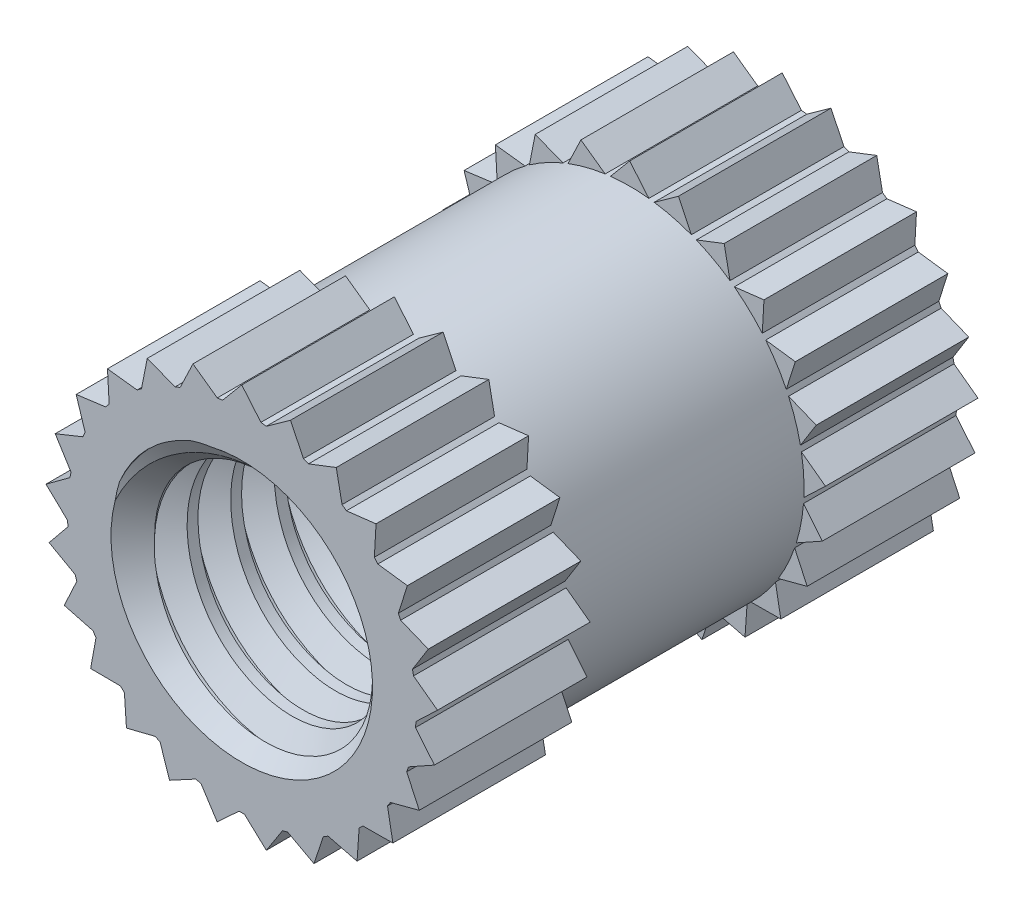
from build123d import *

# Parameters (mm, degrees)
SKETCH1_R             = 2
BOSS_EXTRUDE1_DEPTH   = 3.1
THREAD1_PITCH         = 0.5
BOSS_EXTRUDE2_DEPTH   = 1.75
CIRPATTERN1_COUNT     = 25
MIRROR1_COPY_1_DEPTH  = 1.75
MIRROR1_COPY_2_DEPTH  = 1.75
MIRROR1_COPY_3_DEPTH  = 1.75
MIRROR1_COPY_4_DEPTH  = 1.75
MIRROR1_COPY_5_DEPTH  = 1.75
MIRROR1_COPY_6_DEPTH  = 1.75
MIRROR1_COPY_7_DEPTH  = 1.75
MIRROR1_COPY_8_DEPTH  = 1.75
MIRROR1_COPY_9_DEPTH  = 1.75
MIRROR1_COPY_10_DEPTH = 1.75
MIRROR1_COPY_11_DEPTH = 1.75
MIRROR1_COPY_12_DEPTH = 1.75
MIRROR1_COPY_13_DEPTH = 1.75
MIRROR1_COPY_14_DEPTH = 1.75
MIRROR1_COPY_15_DEPTH = 1.75
MIRROR1_COPY_16_DEPTH = 1.75
MIRROR1_COPY_17_DEPTH = 1.75
MIRROR1_COPY_18_DEPTH = 1.75
MIRROR1_COPY_19_DEPTH = 1.75
MIRROR1_COPY_20_DEPTH = 1.75
MIRROR1_COPY_21_DEPTH = 1.75
MIRROR1_COPY_22_DEPTH = 1.75
MIRROR1_COPY_23_DEPTH = 1.75
MIRROR1_COPY_24_DEPTH = 1.75


with BuildPart() as part:
    # Sketch1 → Boss-Extrude1 (new, symmetric)
    with BuildSketch(Plane.XY):
        with Locations(Location((0, 0, 0), (0, 0, 180))):
            Circle(SKETCH1_R)
    extrude(amount=BOSS_EXTRUDE1_DEPTH, both=True)

    # Sketch3 → Tap Drill for M3x0.5 Tap1 (revolve, cut)
    with BuildSketch(Plane(origin=(0, 0, 3.1), x_dir=(0, -1, 0), z_dir=(1, 0, 0))):
        Polygon((0, 0), (0, 6.2), (1.5, 6.2), (1.25, 5.95), (1.25, 0.25), (1.5, 0), align=None)
    revolve(axis=Axis((0, 0, 9.45), (0, 0, -1)), mode=Mode.SUBTRACT)

    # Thread1: the profile of Thread Profile1 profile screwed along a right-hand helix of 16 turns, 6 arcs to a turn; built about Z, then put on its axis
    thread1_z = Axis((0, 0, 0), (0, 0, 1))
    thread1_corners = [(1.2497, 0, -0.000173205), (1.520632937, 0, 0.156249999), (1.520632937, 0, 0.218749999), (1.2497, 0, 0.375173204)]
    with BuildLine(mode=Mode.PRIVATE) as thread1_profile:
        Line(thread1_corners[0], thread1_corners[1])
        Line(thread1_corners[1], thread1_corners[2])
        Line(thread1_corners[2], thread1_corners[3])
        Line(thread1_corners[3], thread1_corners[0])
    thread1_cap = Face(thread1_profile.wire())
    thread1_turn_angles = [0, 30, 60, 90, 120, 150, 180, 210, 240, 270, 300, 330, 360]
    thread1_turn_weights = [1, 0.8660254037844387, 1, 0.8660254037844387, 1, 0.8660254037844387, 1, 0.8660254037844387, 1, 0.8660254037844387, 1, 0.8660254037844387, 1]
    thread1_turn_rails = [Edge.make_bspline([Vector(p[0], p[1], 0).rotate(thread1_z, thread1_turn_angles[k]) / thread1_turn_weights[k] + Vector(0, 0, p[2] + THREAD1_PITCH * thread1_turn_angles[k] / 360) for k in range(13)], [0, 0, 0, 1, 1, 2, 2, 3, 3, 4, 4, 5, 5, 6, 6, 6], 2, thread1_turn_weights) for p in thread1_corners]
    thread1_turn_sides = [Face.make_surface_from_curves(thread1_turn_rails[p[0]], thread1_turn_rails[p[1]]) for p in [(0, 1), (1, 2), (2, 3), (3, 0)]]
    thread1 = Plane(origin=(0, 0, 3.85), x_dir=(-1, 0, 0), z_dir=(0, 0, -1)) * Solid(Shell([*[p.moved(Location((0, 0, THREAD1_PITCH * i))) for i in range(16) for p in thread1_turn_sides], thread1_cap, thread1_cap.rotate(thread1_z, 5760).moved(Location((0, 0, THREAD1_PITCH * 5760 / 360)))]))
    add(thread1, mode=Mode.SUBTRACT)

    # Sketch6 → Boss-Extrude2 (add)
    with BuildSketch(Plane.XY.offset(3.1)):
        with BuildLine():
            Line((0, 2.25), (-0.219954708, 1.987868186))
            ThreePointArc((-0.219954708, 1.987868186), (0, 2), (0.219954708, 1.987868186))
            Line((0.219954708, 1.987868186), (0, 2.25))
        make_face()
    boss_extrude2 = extrude(amount=-BOSS_EXTRUDE2_DEPTH)

    # CirPattern1: Boss-Extrude2 ×25 about axis
    cirpattern1_axis = Axis((0, 0, 0), (0, 0, 1))
    for i in range(1, CIRPATTERN1_COUNT):
        add(boss_extrude2.rotate(cirpattern1_axis, i * 360 / CIRPATTERN1_COUNT))

    # Mirror1: Boss-Extrude2 across plane
    add(boss_extrude2.mirror(Plane.XY))

    # Mirror1 copy 1 sketch → Mirror1 copy 1 (add)
    with BuildSketch(Plane(origin=(0, 0, -3.1), x_dir=(0.9685831611286311, 0.2486898871648548, 0), z_dir=(0, 0, -1))):
        with BuildLine():
            Line((0, -2.25), (-0.219954708, -1.987868186))
            ThreePointArc((-0.219954708, -1.987868186), (0, -2), (0.219954708, -1.987868186))
            Line((0.219954708, -1.987868186), (0, -2.25))
        make_face()
    extrude(amount=-MIRROR1_COPY_1_DEPTH)

    # Mirror1 copy 2 sketch → Mirror1 copy 2 (add)
    with BuildSketch(Plane(origin=(0, 0, -3.1), x_dir=(0.8763066800438636, 0.4817536741017153, 0), z_dir=(0, 0, -1))):
        with BuildLine():
            Line((0, -2.25), (-0.219954708, -1.987868186))
            ThreePointArc((-0.219954708, -1.987868186), (0, -2), (0.219954708, -1.987868186))
            Line((0.219954708, -1.987868186), (0, -2.25))
        make_face()
    extrude(amount=-MIRROR1_COPY_2_DEPTH)

    # Mirror1 copy 3 sketch → Mirror1 copy 3 (add)
    with BuildSketch(Plane(origin=(0, 0, -3.1), x_dir=(0.7289686274214116, 0.6845471059286887, 0), z_dir=(0, 0, -1))):
        with BuildLine():
            Line((0, -2.25), (-0.219954708, -1.987868186))
            ThreePointArc((-0.219954708, -1.987868186), (0, -2), (0.219954708, -1.987868186))
            Line((0.219954708, -1.987868186), (0, -2.25))
        make_face()
    extrude(amount=-MIRROR1_COPY_3_DEPTH)

    # Mirror1 copy 4 sketch → Mirror1 copy 4 (add)
    with BuildSketch(Plane(origin=(0, 0, -3.1), x_dir=(0.5358267949789965, 0.8443279255020151, 0), z_dir=(0, 0, -1))):
        with BuildLine():
            Line((0, -2.25), (-0.219954708, -1.987868186))
            ThreePointArc((-0.219954708, -1.987868186), (0, -2), (0.219954708, -1.987868186))
            Line((0.219954708, -1.987868186), (0, -2.25))
        make_face()
    extrude(amount=-MIRROR1_COPY_4_DEPTH)

    # Mirror1 copy 5 sketch → Mirror1 copy 5 (add)
    with BuildSketch(Plane(origin=(0, 0, -3.1), x_dir=(0.30901699437494745, 0.9510565162951535, 0), z_dir=(0, 0, -1))):
        with BuildLine():
            Line((0, -2.25), (-0.219954708, -1.987868186))
            ThreePointArc((-0.219954708, -1.987868186), (0, -2), (0.219954708, -1.987868186))
            Line((0.219954708, -1.987868186), (0, -2.25))
        make_face()
    extrude(amount=-MIRROR1_COPY_5_DEPTH)

    # Mirror1 copy 6 sketch → Mirror1 copy 6 (add)
    with BuildSketch(Plane(origin=(0, 0, -3.1), x_dir=(0.0627905195293133, 0.9980267284282716, 0), z_dir=(0, 0, -1))):
        with BuildLine():
            Line((0, -2.25), (-0.219954708, -1.987868186))
            ThreePointArc((-0.219954708, -1.987868186), (0, -2), (0.219954708, -1.987868186))
            Line((0.219954708, -1.987868186), (0, -2.25))
        make_face()
    extrude(amount=-MIRROR1_COPY_6_DEPTH)

    # Mirror1 copy 7 sketch → Mirror1 copy 7 (add)
    with BuildSketch(Plane(origin=(0, 0, -3.1), x_dir=(-0.1873813145857246, 0.9822872507286887, 0), z_dir=(0, 0, -1))):
        with BuildLine():
            Line((0, -2.25), (-0.219954708, -1.987868186))
            ThreePointArc((-0.219954708, -1.987868186), (0, -2), (0.219954708, -1.987868186))
            Line((0.219954708, -1.987868186), (0, -2.25))
        make_face()
    extrude(amount=-MIRROR1_COPY_7_DEPTH)

    # Mirror1 copy 8 sketch → Mirror1 copy 8 (add)
    with BuildSketch(Plane(origin=(0, 0, -3.1), x_dir=(-0.4257792915650727, 0.9048270524660195, 0), z_dir=(0, 0, -1))):
        with BuildLine():
            Line((0, -2.25), (-0.219954708, -1.987868186))
            ThreePointArc((-0.219954708, -1.987868186), (0, -2), (0.219954708, -1.987868186))
            Line((0.219954708, -1.987868186), (0, -2.25))
        make_face()
    extrude(amount=-MIRROR1_COPY_8_DEPTH)

    # Mirror1 copy 9 sketch → Mirror1 copy 9 (add)
    with BuildSketch(Plane(origin=(0, 0, -3.1), x_dir=(-0.6374239897486897, 0.7705132427757893, 0), z_dir=(0, 0, -1))):
        with BuildLine():
            Line((0, -2.25), (-0.219954708, -1.987868186))
            ThreePointArc((-0.219954708, -1.987868186), (0, -2), (0.219954708, -1.987868186))
            Line((0.219954708, -1.987868186), (0, -2.25))
        make_face()
    extrude(amount=-MIRROR1_COPY_9_DEPTH)

    # Mirror1 copy 10 sketch → Mirror1 copy 10 (add)
    with BuildSketch(Plane(origin=(0, 0, -3.1), x_dir=(-0.8090169943749473, 0.5877852522924732, 0), z_dir=(0, 0, -1))):
        with BuildLine():
            Line((0, -2.25), (-0.219954708, -1.987868186))
            ThreePointArc((-0.219954708, -1.987868186), (0, -2), (0.219954708, -1.987868186))
            Line((0.219954708, -1.987868186), (0, -2.25))
        make_face()
    extrude(amount=-MIRROR1_COPY_10_DEPTH)

    # Mirror1 copy 11 sketch → Mirror1 copy 11 (add)
    with BuildSketch(Plane(origin=(0, 0, -3.1), x_dir=(-0.9297764858882515, 0.36812455268467775, 0), z_dir=(0, 0, -1))):
        with BuildLine():
            Line((0, -2.25), (-0.219954708, -1.987868186))
            ThreePointArc((-0.219954708, -1.987868186), (0, -2), (0.219954708, -1.987868186))
            Line((0.219954708, -1.987868186), (0, -2.25))
        make_face()
    extrude(amount=-MIRROR1_COPY_11_DEPTH)

    # Mirror1 copy 12 sketch → Mirror1 copy 12 (add)
    with BuildSketch(Plane(origin=(0, 0, -3.1), x_dir=(-0.9921147013144779, 0.1253332335643041, 0), z_dir=(0, 0, -1))):
        with BuildLine():
            Line((0, -2.25), (-0.219954708, -1.987868186))
            ThreePointArc((-0.219954708, -1.987868186), (0, -2), (0.219954708, -1.987868186))
            Line((0.219954708, -1.987868186), (0, -2.25))
        make_face()
    extrude(amount=-MIRROR1_COPY_12_DEPTH)

    # Mirror1 copy 13 sketch → Mirror1 copy 13 (add)
    with BuildSketch(Plane(origin=(0, 0, -3.1), x_dir=(-0.9921147013144779, -0.12533323356430429, 0), z_dir=(0, 0, -1))):
        with BuildLine():
            Line((0, -2.25), (-0.219954708, -1.987868186))
            ThreePointArc((-0.219954708, -1.987868186), (0, -2), (0.219954708, -1.987868186))
            Line((0.219954708, -1.987868186), (0, -2.25))
        make_face()
    extrude(amount=-MIRROR1_COPY_13_DEPTH)

    # Mirror1 copy 14 sketch → Mirror1 copy 14 (add)
    with BuildSketch(Plane(origin=(0, 0, -3.1), x_dir=(-0.9297764858882515, -0.3681245526846779, 0), z_dir=(0, 0, -1))):
        with BuildLine():
            Line((0, -2.25), (-0.219954708, -1.987868186))
            ThreePointArc((-0.219954708, -1.987868186), (0, -2), (0.219954708, -1.987868186))
            Line((0.219954708, -1.987868186), (0, -2.25))
        make_face()
    extrude(amount=-MIRROR1_COPY_14_DEPTH)

    # Mirror1 copy 15 sketch → Mirror1 copy 15 (add)
    with BuildSketch(Plane(origin=(0, 0, -3.1), x_dir=(-0.8090169943749476, -0.587785252292473, 0), z_dir=(0, 0, -1))):
        with BuildLine():
            Line((0, -2.25), (-0.219954708, -1.987868186))
            ThreePointArc((-0.219954708, -1.987868186), (0, -2), (0.219954708, -1.987868186))
            Line((0.219954708, -1.987868186), (0, -2.25))
        make_face()
    extrude(amount=-MIRROR1_COPY_15_DEPTH)

    # Mirror1 copy 16 sketch → Mirror1 copy 16 (add)
    with BuildSketch(Plane(origin=(0, 0, -3.1), x_dir=(-0.6374239897486895, -0.7705132427757894, 0), z_dir=(0, 0, -1))):
        with BuildLine():
            Line((0, -2.25), (-0.219954708, -1.987868186))
            ThreePointArc((-0.219954708, -1.987868186), (0, -2), (0.219954708, -1.987868186))
            Line((0.219954708, -1.987868186), (0, -2.25))
        make_face()
    extrude(amount=-MIRROR1_COPY_16_DEPTH)

    # Mirror1 copy 17 sketch → Mirror1 copy 17 (add)
    with BuildSketch(Plane(origin=(0, 0, -3.1), x_dir=(-0.42577929156507216, -0.9048270524660198, 0), z_dir=(0, 0, -1))):
        with BuildLine():
            Line((0, -2.25), (-0.219954708, -1.987868186))
            ThreePointArc((-0.219954708, -1.987868186), (0, -2), (0.219954708, -1.987868186))
            Line((0.219954708, -1.987868186), (0, -2.25))
        make_face()
    extrude(amount=-MIRROR1_COPY_17_DEPTH)

    # Mirror1 copy 18 sketch → Mirror1 copy 18 (add)
    with BuildSketch(Plane(origin=(0, 0, -3.1), x_dir=(-0.18738131458572463, -0.9822872507286887, 0), z_dir=(0, 0, -1))):
        with BuildLine():
            Line((0, -2.25), (-0.219954708, -1.987868186))
            ThreePointArc((-0.219954708, -1.987868186), (0, -2), (0.219954708, -1.987868186))
            Line((0.219954708, -1.987868186), (0, -2.25))
        make_face()
    extrude(amount=-MIRROR1_COPY_18_DEPTH)

    # Mirror1 copy 19 sketch → Mirror1 copy 19 (add)
    with BuildSketch(Plane(origin=(0, 0, -3.1), x_dir=(0.06279051952931372, -0.9980267284282716, 0), z_dir=(0, 0, -1))):
        with BuildLine():
            Line((0, -2.25), (-0.219954708, -1.987868186))
            ThreePointArc((-0.219954708, -1.987868186), (0, -2), (0.219954708, -1.987868186))
            Line((0.219954708, -1.987868186), (0, -2.25))
        make_face()
    extrude(amount=-MIRROR1_COPY_19_DEPTH)

    # Mirror1 copy 20 sketch → Mirror1 copy 20 (add)
    with BuildSketch(Plane(origin=(0, 0, -3.1), x_dir=(0.30901699437494723, -0.9510565162951536, 0), z_dir=(0, 0, -1))):
        with BuildLine():
            Line((0, -2.25), (-0.219954708, -1.987868186))
            ThreePointArc((-0.219954708, -1.987868186), (0, -2), (0.219954708, -1.987868186))
            Line((0.219954708, -1.987868186), (0, -2.25))
        make_face()
    extrude(amount=-MIRROR1_COPY_20_DEPTH)

    # Mirror1 copy 21 sketch → Mirror1 copy 21 (add)
    with BuildSketch(Plane(origin=(0, 0, -3.1), x_dir=(0.5358267949789968, -0.844327925502015, 0), z_dir=(0, 0, -1))):
        with BuildLine():
            Line((0, -2.25), (-0.219954708, -1.987868186))
            ThreePointArc((-0.219954708, -1.987868186), (0, -2), (0.219954708, -1.987868186))
            Line((0.219954708, -1.987868186), (0, -2.25))
        make_face()
    extrude(amount=-MIRROR1_COPY_21_DEPTH)

    # Mirror1 copy 22 sketch → Mirror1 copy 22 (add)
    with BuildSketch(Plane(origin=(0, 0, -3.1), x_dir=(0.7289686274214119, -0.6845471059286883, 0), z_dir=(0, 0, -1))):
        with BuildLine():
            Line((0, -2.25), (-0.219954708, -1.987868186))
            ThreePointArc((-0.219954708, -1.987868186), (0, -2), (0.219954708, -1.987868186))
            Line((0.219954708, -1.987868186), (0, -2.25))
        make_face()
    extrude(amount=-MIRROR1_COPY_22_DEPTH)

    # Mirror1 copy 23 sketch → Mirror1 copy 23 (add)
    with BuildSketch(Plane(origin=(0, 0, -3.1), x_dir=(0.8763066800438636, -0.4817536741017153, 0), z_dir=(0, 0, -1))):
        with BuildLine():
            Line((0, -2.25), (-0.219954708, -1.987868186))
            ThreePointArc((-0.219954708, -1.987868186), (0, -2), (0.219954708, -1.987868186))
            Line((0.219954708, -1.987868186), (0, -2.25))
        make_face()
    extrude(amount=-MIRROR1_COPY_23_DEPTH)

    # Mirror1 copy 24 sketch → Mirror1 copy 24 (add)
    with BuildSketch(Plane(origin=(0, 0, -3.1), x_dir=(0.9685831611286312, -0.2486898871648545, 0), z_dir=(0, 0, -1))):
        with BuildLine():
            Line((0, -2.25), (-0.219954708, -1.987868186))
            ThreePointArc((-0.219954708, -1.987868186), (0, -2), (0.219954708, -1.987868186))
            Line((0.219954708, -1.987868186), (0, -2.25))
        make_face()
    extrude(amount=-MIRROR1_COPY_24_DEPTH)


solid = part.part
